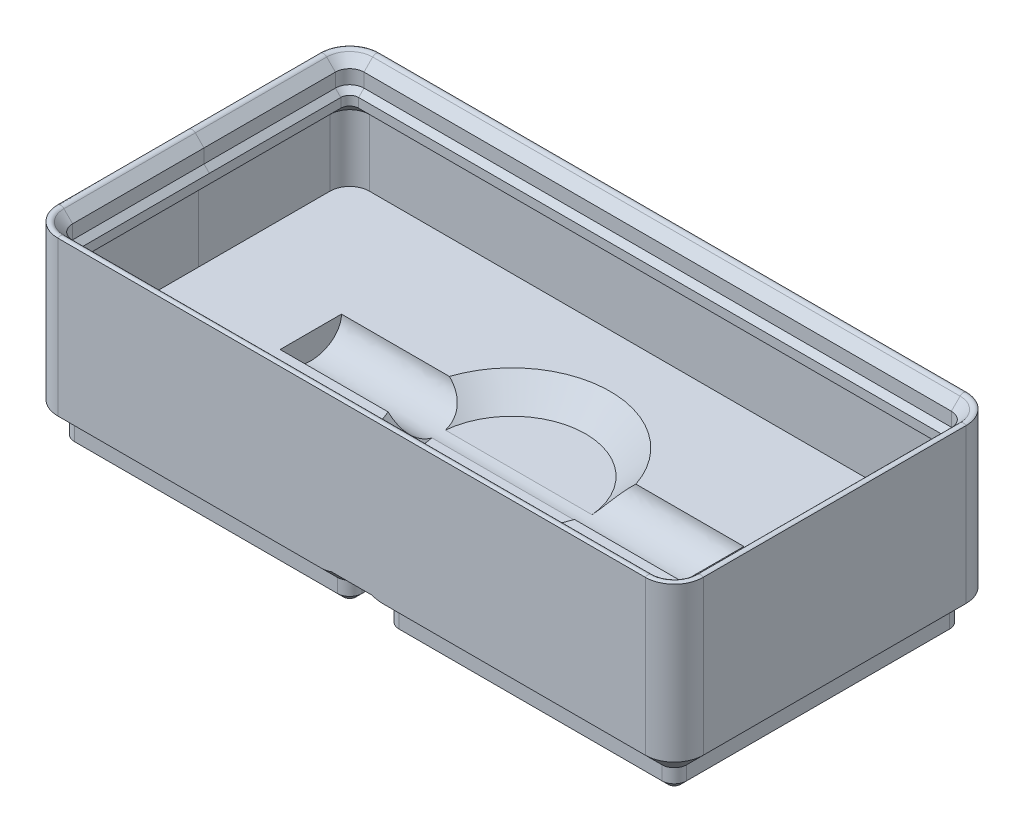
from build123d import *

# Parameters (mm, degrees)
BASE_DEPTH                          = 5
BOX_START                           = -42
BOX_OUTLINE_W                       = 84
BOX_OUTLINE_H                       = 16
BOX_DEPTH                           = 42
CORNER_FILLET_R                     = 4
BASE_CHAMFER_1_SIZE                 = 2.4
BASE_CHAMFER_2_SIZE                 = 0.8
BASE_PATTERN_COUNT                  = 2
BASE_PATTERN_PITCH                  = 42
BASE_CHAMFER_1_OF_BASE_PATTERN_SIZE = 2.4
BASE_CHAMFER_2_OF_BASE_PATTERN_SIZE = 0.8
INTERIOR_CUT_DEPTH                  = 13.8
TOP_EDGE_FILLET_R                   = 0.6
NESTING_CLEARANCE_CUT_DEPTH         = 98.133602789
BOSS_EXTRUDE1_START                 = 2.6
BOSS_EXTRUDE1_DEPTH                 = 2.6
SKETCH17_R                          = 12.7
CUT_EXTRUDE1_DEPTH                  = 3.175
CHAMFER1_SIZE                       = 3.175
CAVITY1_START                       = 15.965
CAVITY1_DEPTH                       = 52.07


# Read off the part's stored shape, not the designer's step: Box, Cavity1
with BuildPart() as part:
    # Master → Base (new body)
    with BuildSketch(Plane(origin=(0, 0, 0), x_dir=(1, 0, 0), z_dir=(0, 1, 0))):
        with BuildLine():
            Line((4, 2.4), (38, 2.4))
            ThreePointArc((38, 2.4), (39.13137085, 2.86862915), (39.6, 4))
            Line((39.6, 4), (39.6, 38))
            ThreePointArc((39.6, 38), (39.13137085, 39.13137085), (38, 39.6))
            Line((38, 39.6), (4, 39.6))
            ThreePointArc((4, 39.6), (2.86862915, 39.13137085), (2.4, 38))
            Line((2.4, 38), (2.4, 4))
            ThreePointArc((2.4, 4), (2.86862915, 2.86862915), (4, 2.4))
        make_face()
    base = extrude(amount=-BASE_DEPTH)

    # Box outline → Box (add)
    with BuildSketch(Plane.XY.offset(BOX_START)):
        with Locations((42, 8)):
            Rectangle(BOX_OUTLINE_W, BOX_OUTLINE_H)
    extrude(amount=BOX_DEPTH)

    # Corner Fillet
    corner_fillet_edges = [part.edges().sort_by_distance(p)[0] for p in [
        (0, 8, 0),
        (84, 8, 0),
        (84, 8, -42),
        (0, 8, -42),
    ]]
    fillet(corner_fillet_edges, radius=CORNER_FILLET_R)

    # Base Chamfer 1
    base_chamfer_1_edges = [part.edges().sort_by_distance(p)[0] for p in [
        (21, 0, -39.6),
        (2.86862915, 0, -39.13137085),
        (2.4, 0, -21),
        (2.86862915, 0, -2.86862915),
        (21, 0, -2.4),
        (39.13137085, 0, -2.86862915),
        (39.6, 0, -21),
        (39.13137085, 0, -39.13137085),
    ]]
    chamfer(base_chamfer_1_edges, length=BASE_CHAMFER_1_SIZE - 0.0001)  # a hair under: the kernel refuses the full size

    # Base Chamfer 2
    base_chamfer_2_edges = [part.edges().sort_by_distance(p)[0] for p in [
        (2.86862915, -5, -39.13137085),
        (21, -5, -39.6),
        (39.13137085, -5, -39.13137085),
        (39.6, -5, -21),
        (39.13137085, -5, -2.86862915),
        (21, -5, -2.4),
        (2.86862915, -5, -2.86862915),
        (2.4, -5, -21),
    ]]
    chamfer(base_chamfer_2_edges, length=BASE_CHAMFER_2_SIZE)

    # Base Pattern: Base ×2
    with Locations(*[(i * BASE_PATTERN_PITCH, 0, 0) for i in range(1, BASE_PATTERN_COUNT)]):
        add(base)

    # Base Chamfer 1 of Base Pattern
    base_chamfer_1_of_base_pattern_edges = [part.edges().sort_by_distance(p)[0] for p in [
        (63, 0, -39.6),
        (44.86862915, 0, -39.13137085),
        (44.4, 0, -21),
        (44.86862915, 0, -2.86862915),
        (63, 0, -2.4),
        (81.13137085, 0, -2.86862915),
        (81.6, 0, -21),
        (81.13137085, 0, -39.13137085),
    ]]
    chamfer(base_chamfer_1_of_base_pattern_edges, length=BASE_CHAMFER_1_OF_BASE_PATTERN_SIZE - 0.0001)  # a hair under: the kernel refuses the full size

    # Base Chamfer 2 of Base Pattern
    base_chamfer_2_of_base_pattern_edges = [part.edges().sort_by_distance(p)[0] for p in [
        (44.86862915, -5, -39.13137085),
        (63, -5, -39.6),
        (81.13137085, -5, -39.13137085),
        (81.6, -5, -21),
        (81.13137085, -5, -2.86862915),
        (63, -5, -2.4),
        (44.86862915, -5, -2.86862915),
        (44.4, -5, -21),
    ]]
    chamfer(base_chamfer_2_of_base_pattern_edges, length=BASE_CHAMFER_2_OF_BASE_PATTERN_SIZE)

    # Top Nesting Feature: sweep along a path in Sketch5
    with BuildLine(Plane(origin=(0, 16, 0), x_dir=(1, 0, 0), z_dir=(0, 1, 0))) as top_nesting_feature_path:
        Line((4, 0), (80, 0))
        ThreePointArc((80, 0), (82.828427125, 1.171572875), (84, 4))
        Line((84, 4), (84, 38))
        ThreePointArc((84, 38), (82.828427125, 40.828427125), (80, 42))
        Line((80, 42), (4, 42))
        ThreePointArc((4, 42), (1.171572875, 40.828427125), (0, 38))
        Line((0, 38), (0, 4))
        ThreePointArc((0, 4), (1.171572875, 1.171572875), (4, 0))
    # Sketch4 → Top Nesting Feature (sweep)
    with BuildSketch(Plane(origin=(0, 0, -21), x_dir=(-1, 0, 0), z_dir=(0, 0, -1))):
        Polygon((0, 16), (0, 20.646446609), (-2.15, 18.496446609), (-2.15, 16.696446609), (-2.846446609, 16), align=None)
    sweep(path=top_nesting_feature_path.line)

    # Sketch6 → Interior Cut (cut)
    with BuildSketch(Plane(origin=(0, 16, 0), x_dir=(1, 0, 0), z_dir=(0, 1, 0))):
        with BuildLine():
            Line((2.846446609, 38), (2.846446609, 21))
            Line((2.846446609, 21), (2.846446609, 4))
            ThreePointArc((2.846446609, 4), (3.184314575, 3.184314575), (4, 2.846446609))
            Line((4, 2.846446609), (80, 2.846446609))
            ThreePointArc((80, 2.846446609), (80.815685425, 3.184314575), (81.153553391, 4))
            Line((81.153553391, 4), (81.153553391, 38))
            ThreePointArc((81.153553391, 38), (80.815685425, 38.815685425), (80, 39.153553391))
            Line((80, 39.153553391), (4, 39.153553391))
            ThreePointArc((4, 39.153553391), (3.184314575, 38.815685425), (2.846446609, 38))
        make_face()
    extrude(amount=-INTERIOR_CUT_DEPTH, mode=Mode.SUBTRACT)

    # Interior Sweep: sweep along a path in Sketch7
    with BuildLine(Plane(origin=(0, 2.2, 0), x_dir=(1, 0, 0), z_dir=(0, 1, 0))) as interior_sweep_path:
        Line((4, 1.2), (80, 1.2))
        ThreePointArc((80, 1.2), (81.979898987, 2.020101013), (82.8, 4))
        Line((82.8, 4), (82.8, 38))
        ThreePointArc((82.8, 38), (81.979898987, 39.979898987), (80, 40.8))
        Line((80, 40.8), (4, 40.8))
        ThreePointArc((4, 40.8), (2.020101013, 39.979898987), (1.2, 38))
        Line((1.2, 38), (1.2, 4))
        ThreePointArc((1.2, 4), (2.020101013, 2.020101013), (4, 1.2))
    # Sketch8 → Interior Sweep (sweep, cut)
    with BuildSketch(Plane(origin=(0, 0, -21), x_dir=(-1, 0, 0), z_dir=(0, 0, -1))):
        Polygon((-2.846446609, 14.8), (-1.45, 13.403553391), (-1.45, 2.2), (-2.846446609, 2.2), align=None)
    sweep(path=interior_sweep_path.line, mode=Mode.SUBTRACT)

    # Top Edge Fillet
    top_edge_fillet_edges = [part.edges().sort_by_distance(p)[0] for p in [
        (0, 20.646446609, -21),
        (1.171572875, 20.646446609, -1.171572875),
        (42, 20.646446609, 0),
        (82.828427125, 20.646446609, -1.171572875),
        (84, 20.646446609, -21),
        (82.828427125, 20.646446609, -40.828427125),
        (42, 20.646446609, -42),
        (1.171572875, 20.646446609, -40.828427125),
        (0, 20.646446609, -21),
    ]]
    fillet(top_edge_fillet_edges, radius=TOP_EDGE_FILLET_R)

    # Sketch14 → Nesting Clearance Cut (cut, through all)
    with BuildSketch(Plane.XZ.offset(5)):
        with BuildLine():
            Line((-1, -4), (-1, -38))
            ThreePointArc((-1, -38), (0.464466094, -41.535533906), (4, -43))
            Line((4, -43), (80, -43))
            ThreePointArc((80, -43), (83.535533906, -41.535533906), (85, -38))
            Line((85, -38), (85, -4))
            ThreePointArc((85, -4), (83.535533906, -0.464466094), (80, 1))
            Line((80, 1), (4, 1))
            ThreePointArc((4, 1), (0.464466094, -0.464466094), (-1, -4))
        make_face()
        with BuildLine():
            Line((0.25, -4), (0.25, -38))
            ThreePointArc((0.25, -38), (1.348349571, -40.651650429), (4, -41.75))
            Line((4, -41.75), (80, -41.75))
            ThreePointArc((80, -41.75), (82.651650429, -40.651650429), (83.75, -38))
            Line((83.75, -38), (83.75, -4))
            ThreePointArc((83.75, -4), (82.651650429, -1.348349571), (80, -0.25))
            Line((80, -0.25), (4, -0.25))
            ThreePointArc((4, -0.25), (1.348349571, -1.348349571), (0.25, -4))
        make_face(mode=Mode.SUBTRACT)
    extrude(amount=-NESTING_CLEARANCE_CUT_DEPTH, mode=Mode.SUBTRACT)

    # Sketch16 → Boss-Extrude1 (add)
    with BuildSketch(Plane(origin=(0, 2.2, 0), x_dir=(1, 0, 0), z_dir=(0, 1, 0)).offset(BOSS_EXTRUDE1_START)):
        with BuildLine():
            Line((82.55, 4), (82.55, 38))
            ThreePointArc((82.55, 38), (81.803122292, 39.803122292), (80, 40.55))
            Line((80, 40.55), (4, 40.55))
            ThreePointArc((4, 40.55), (2.196877708, 39.803122292), (1.45, 38))
            Line((1.45, 38), (1.45, 21))
            Line((1.45, 21), (1.45, 4))
            ThreePointArc((1.45, 4), (1.519917935, 3.406962941), (1.72583761, 2.846446609))
            ThreePointArc((1.72583761, 2.846446609), (2.66565768, 1.826976629), (4, 1.45))
            Line((4, 1.45), (80, 1.45))
            ThreePointArc((80, 1.45), (81.33434232, 1.826976629), (82.27416239, 2.846446609))
            ThreePointArc((82.27416239, 2.846446609), (82.480082065, 3.406962941), (82.55, 4))
        make_face()
    extrude(amount=-BOSS_EXTRUDE1_DEPTH)

    # Sketch17 → Cut-Extrude1 (cut)
    with BuildSketch(Plane(origin=(0, 4.8, 0), x_dir=(1, 0, 0), z_dir=(0, 1, 0))):
        with Locations(Location((42, 21, 0), (0, 0, 180))):
            Circle(SKETCH17_R)
    extrude(amount=-CUT_EXTRUDE1_DEPTH, mode=Mode.SUBTRACT)

    # Chamfer1
    chamfer1_edges = [part.edges().sort_by_distance(p)[0] for p in [
        (54.7, 1.625, -21),
    ]]
    chamfer(chamfer1_edges, length=CHAMFER1_SIZE - 0.0001)  # a hair under: the kernel refuses the full size

    # Cavity1 outline → Cavity1 (cut)
    with BuildSketch(Plane.YZ.offset(CAVITY1_START)):
        with BuildLine():
            Line((4.8, -24.96875), (4.8, -17.03125))
            add(Edge.make_bspline(
                [(4.8, -17.03125), (3.932166667, -17.03125), (3.057966257, -17.371159023), (2.387683986, -18.042936041), (1.97293297, -18.811309504), (1.741158537, -19.499225411), (1.595960366, -20.286207367), (1.574351738, -20.439177361), (1.559292593, -20.587250483), (1.549963998, -20.730135488), (1.545625, -20.867708333), (1.545625, -21.132291667), (1.549963998, -21.269864512), (1.559292593, -21.412749517), (1.574351738, -21.560822639), (1.595960366, -21.713792633), (1.741158537, -22.500774589), (1.97293297, -23.188690496), (2.387683986, -23.957063959), (3.057966257, -24.628840977), (3.932166667, -24.96875), (4.8, -24.96875)],
                knots=[0.25, 0.25, 0.25, 0.25, 0.25, 0.25, 0.25, 0.45, 0.45, 0.45, 0.45, 0.45, 0.5, 0.5, 0.5, 0.5, 0.5, 0.55, 0.55, 0.55, 0.55, 0.55, 0.75, 0.75, 0.75, 0.75, 0.75, 0.75, 0.75], degree=6, weights=[1, 1, 0.996345033, 1.004264128, 1.009340472, 1, 1, 1.000037438, 1.000057228, 1.000038866, 1, 1, 1.000038866, 1.000057228, 1.000037438, 1, 1, 1.009340472, 1.004264128, 0.996345033, 1, 1]))
        make_face()
    extrude(amount=CAVITY1_DEPTH, mode=Mode.SUBTRACT)


solid = part.part
